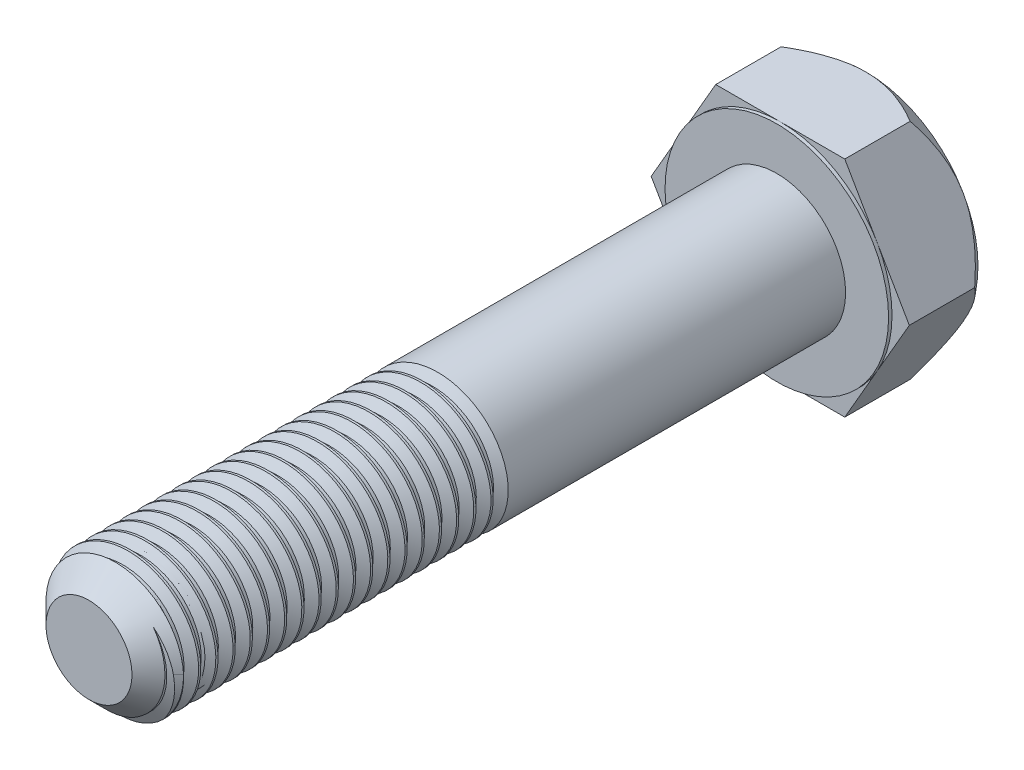
from build123d import *

# Parameters (mm, degrees)
ESBO_O1_R                = 6.5
RESSALTO_EXTRUS_O1_DEPTH = 5
RESSALTO_EXTRUS_O2_START = 5
ESBO_O1_4_R              = 6.5
RESSALTO_EXTRUS_O2_DEPTH = 0.2
RESSALTO_EXTRUS_O3_START = 5.2
ESBO_O2_R                = 4
RESSALTO_EXTRUS_O3_DEPTH = 40
CHANFRO1_SIZE            = 1.5
ESBO_O1_14_OUTSIDE_W     = 31.92
ESBO_O1_14_OUTSIDE_H     = 29.908
ESBO_O1_14_OUTSIDE_R     = 6.5
CORTE_EXTRUS_O6_DEPTH    = 3
CORTE_EXTRUS_O6_DRAFT    = 40
ROSCA1_PITCH             = 1
CORTE_EXTRUS_O8_DEPTH    = 5


with BuildPart() as part:
    # Esboço1 → Ressalto-extrusão1 (new body)
    with BuildSketch(Plane.XY):
        with BuildLine():
            ThreePointArc((-5.629165033, 3.250000159), (-3.249999908, 5.629165177), (2.8e-08, 6.5))
            Line((2.8e-08, 6.5), (-3.75277675, 6.5))
            Line((-3.75277675, 6.5), (-5.629165033, 3.250000159))
        make_face()
        with BuildLine():
            Line((5.629165089, 3.250000062), (3.75277675, 6.5))
            Line((3.75277675, 6.5), (2.8e-08, 6.5))
            ThreePointArc((2.8e-08, 6.5), (3.249999981, 5.629165135), (5.629165089, 3.250000062))
        make_face()
        with BuildLine():
            Line((7.505553499, 0), (5.629165089, 3.250000062))
            ThreePointArc((5.629165089, 3.250000062), (6.278517862, 1.682323828), (6.5, 0))
            ThreePointArc((6.5, 0), (6.278517871, -1.682323794), (5.629165124, -3.250000001))
            Line((5.629165124, -3.250000001), (7.505553499, 0))
        make_face()
        with BuildLine():
            ThreePointArc((-5.629165145, -3.249999964), (-6.5, 1.13e-07), (-5.629165033, 3.250000159))
            Line((-5.629165033, 3.250000159), (-7.505553499, 0))
            Line((-7.505553499, 0), (-5.629165145, -3.249999964))
        make_face()
        with BuildLine():
            ThreePointArc((5.6e-08, -6.5), (-3.249999994, -5.629165128), (-5.629165145, -3.249999964))
            Line((-5.629165145, -3.249999964), (-3.75277675, -6.5))
            Line((-3.75277675, -6.5), (5.6e-08, -6.5))
        make_face()
        with BuildLine():
            Line((3.75277675, -6.5), (5.629165124, -3.250000001))
            ThreePointArc((5.629165124, -3.250000001), (3.250000024, -5.629165111), (5.6e-08, -6.5))
            Line((5.6e-08, -6.5), (3.75277675, -6.5))
        make_face()
        Circle(ESBO_O1_R)
    extrude(amount=RESSALTO_EXTRUS_O1_DEPTH)

    # Esboço1<4> → Ressalto-extrusão2 (add)
    with BuildSketch(Plane.XY.offset(RESSALTO_EXTRUS_O2_START)):
        with Locations(Location((0, 0, 0), (0, 0, 150))):
            Circle(ESBO_O1_4_R)
    extrude(amount=RESSALTO_EXTRUS_O2_DEPTH)

    # Esboço2 → Ressalto-extrusão3 (add)
    with BuildSketch(Plane.XY.offset(RESSALTO_EXTRUS_O3_START)):
        Circle(ESBO_O2_R)
    extrude(amount=RESSALTO_EXTRUS_O3_DEPTH)

    # Chanfro1
    chanfro1_edges = [part.edges().sort_by_distance(p)[0] for p in [
        (-4, 0, 45.2),
    ]]
    chamfer(chanfro1_edges, length=CHANFRO1_SIZE)


with BuildPart() as corte_extrus_o6_tool:
    # Esboço1<14> outside → Corte-extrusão6 (with draft: the straight prism first)
    with BuildSketch(Plane.XY):
        Rectangle(ESBO_O1_14_OUTSIDE_W, ESBO_O1_14_OUTSIDE_H)
        with Locations(Location((0, 0, 0), (0, 0, 150))):
            Circle(ESBO_O1_14_OUTSIDE_R, mode=Mode.SUBTRACT)
    extrude(amount=CORTE_EXTRUS_O6_DEPTH)
    # Corte-extrusão6: the draft: its side faces are tilted about the plane it starts from
    corte_extrus_o6_sides = [corte_extrus_o6_tool.faces().sort_by_distance(p)[0] for p in [
        (0, -14.954, 1.5),
        (15.96, 0, 1.5),
        (0, 14.954, 1.5),
        (-15.96, 0, 1.5),
        (5.629165125, -3.25, 1.5),
    ]]
    draft(corte_extrus_o6_sides, Plane.XY, CORTE_EXTRUS_O6_DRAFT)


with BuildPart() as part_1:
    add(part.part)

    # Corte-extrusão6: cut by corte_extrus_o6_tool
    add(corte_extrus_o6_tool.part, mode=Mode.SUBTRACT)

    # Rosca1: the profile of Perfil da rosca1 profile screwed along a right-hand helix of 20 turns, 8 arcs to a turn; built about Z, then put on its axis
    rosca1_z = Axis((0, 0, 0), (0, 0, 1))
    rosca1_corners = [(4.0003, 0, -0.000173205), (4.0003, 0, 0.875173202), (3.458734125, 0, 0.562499999), (3.458734125, 0, 0.312499999)]
    with BuildLine(mode=Mode.PRIVATE) as rosca1_profile:
        Line(rosca1_corners[0], rosca1_corners[1])
        Line(rosca1_corners[1], rosca1_corners[2])
        Line(rosca1_corners[2], rosca1_corners[3])
        Line(rosca1_corners[3], rosca1_corners[0])
    rosca1_cap = Face(rosca1_profile.wire())
    rosca1_turn_angles = [0, 22.5, 45, 67.5, 90, 112.5, 135, 157.5, 180, 202.5, 225, 247.5, 270, 292.5, 315, 337.5, 360]
    rosca1_turn_weights = [1, 0.9238795325112867, 1, 0.9238795325112867, 1, 0.9238795325112867, 1, 0.9238795325112867, 1, 0.9238795325112867, 1, 0.9238795325112867, 1, 0.9238795325112867, 1, 0.9238795325112867, 1]
    rosca1_turn_rails = [Edge.make_bspline([Vector(p[0], p[1], 0).rotate(rosca1_z, rosca1_turn_angles[k]) / rosca1_turn_weights[k] + Vector(0, 0, p[2] + ROSCA1_PITCH * rosca1_turn_angles[k] / 360) for k in range(17)], [0, 0, 0, 1, 1, 2, 2, 3, 3, 4, 4, 5, 5, 6, 6, 7, 7, 8, 8, 8], 2, rosca1_turn_weights) for p in rosca1_corners]
    rosca1_turn_sides = [Face.make_surface_from_curves(rosca1_turn_rails[p[0]], rosca1_turn_rails[p[1]]) for p in [(0, 1), (1, 2), (2, 3), (3, 0)]]
    rosca1 = Plane(origin=(0, 0, 45.2), x_dir=(-1, 0, 0), z_dir=(0, 0, -1)) * Solid(Shell([*[p.moved(Location((0, 0, ROSCA1_PITCH * i))) for i in range(20) for p in rosca1_turn_sides], rosca1_cap, rosca1_cap.rotate(rosca1_z, 7200).moved(Location((0, 0, ROSCA1_PITCH * 7200 / 360)))]))
    add(rosca1, mode=Mode.SUBTRACT)

    # Esboço12 → Corte-extrusão8 (cut)
    with BuildSketch(Plane.XZ):
        Polygon((-3.458734125, 24.887500001), (-4, 25.2), (-4, 24.325000003), (-3.458734125, 24.637500001), align=None)
    extrude(amount=-CORTE_EXTRUS_O8_DEPTH, mode=Mode.SUBTRACT)


solid = part_1.part
